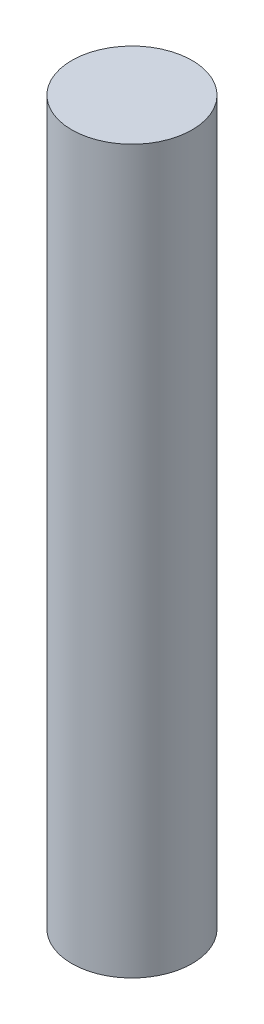
from build123d import *

# Parameters (mm, degrees)
SKETCH1_R           = 1
BOSS_EXTRUDE1_DEPTH = 12


with BuildPart() as part:
    # Sketch1 → Boss-Extrude1 (new body)
    with BuildSketch(Plane(origin=(0, 0, 0), x_dir=(1, 0, 0), z_dir=(0, 1, 0))):
        Circle(SKETCH1_R)
    extrude(amount=BOSS_EXTRUDE1_DEPTH)


solid = part.part
